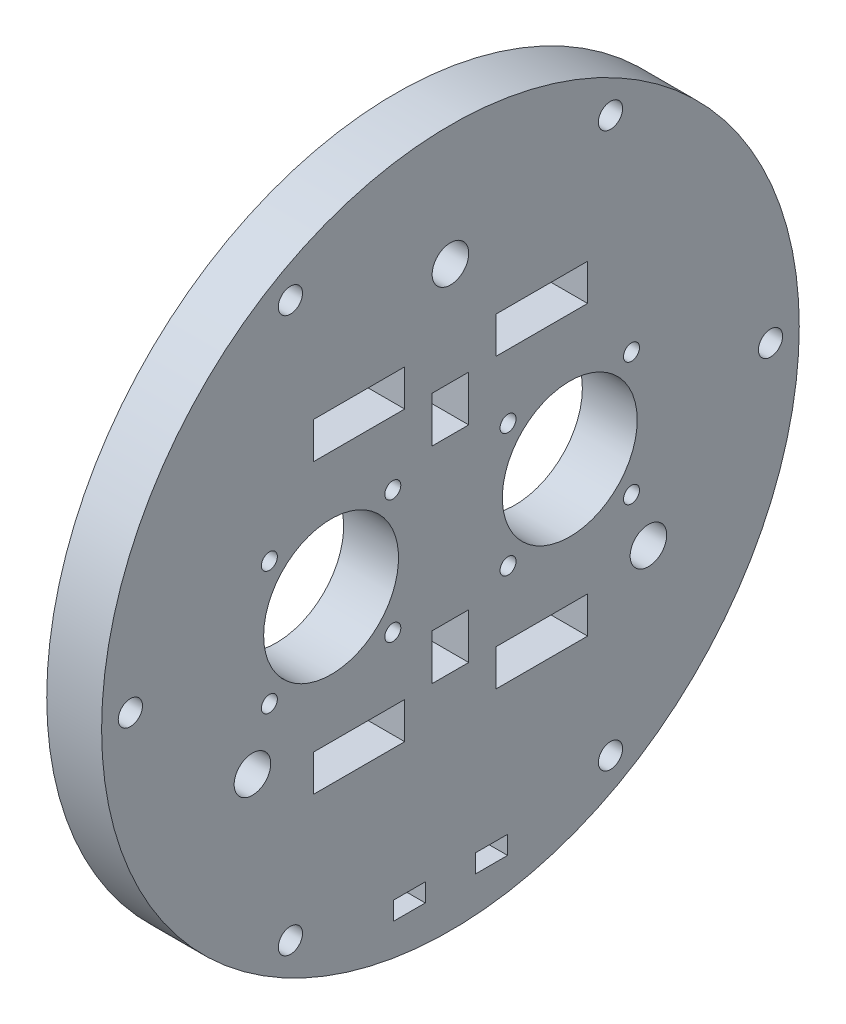
from build123d import *

# Parameters (mm, degrees)
SKETCH1_R           = 76.29
SKETCH1_R_2         = 4
SKETCH1_R_3         = 14.75
SKETCH1_R_4         = 1.75
BOSS_EXTRUDE1_DEPTH = 12
SKETCH2_W           = 20
SKETCH2_H           = 8
SKETCH2_W_2         = 8
SKETCH2_H_2         = 10
SKETCH2_W_3         = 7
SKETCH2_H_3         = 4
CUT_EXTRUDE1_DEPTH  = 8
CUT_EXTRUDE2_REACH  = 110.556
SKETCH3_R           = 2.65


with BuildPart() as part:
    # Sketch1 → Boss-Extrude1 (new body)
    with BuildSketch(Plane(origin=(0, 0, 0), x_dir=(0, 0, -1), z_dir=(1, 0, 0))):
        Circle(SKETCH1_R)
        with Locations((0, 50)):
            Circle(SKETCH1_R_2, mode=Mode.SUBTRACT)
        with Locations((43.301270189, -25)):
            Circle(SKETCH1_R_2, mode=Mode.SUBTRACT)
        with Locations((-43.301270189, -25)):
            Circle(SKETCH1_R_2, mode=Mode.SUBTRACT)
        with Locations((26.1, 0)):
            Circle(SKETCH1_R_3, mode=Mode.SUBTRACT)
        with Locations((-26.1, 0)):
            Circle(SKETCH1_R_3, mode=Mode.SUBTRACT)
        with Locations((39.596900686, 13.496900686)):
            Circle(SKETCH1_R_4, mode=Mode.SUBTRACT)
        with Locations((39.596900686, -13.496900686)):
            Circle(SKETCH1_R_4, mode=Mode.SUBTRACT)
        with Locations((12.603099314, -13.496900686)):
            Circle(SKETCH1_R_4, mode=Mode.SUBTRACT)
        with Locations((12.603099314, 13.496900686)):
            Circle(SKETCH1_R_4, mode=Mode.SUBTRACT)
        with Locations((-39.596900686, -13.496900686)):
            Circle(SKETCH1_R_4, mode=Mode.SUBTRACT)
        with Locations((-12.603099314, -13.496900686)):
            Circle(SKETCH1_R_4, mode=Mode.SUBTRACT)
        with Locations((-12.603099314, 13.496900686)):
            Circle(SKETCH1_R_4, mode=Mode.SUBTRACT)
        with Locations((-39.596900686, 13.496900686)):
            Circle(SKETCH1_R_4, mode=Mode.SUBTRACT)
    extrude(amount=BOSS_EXTRUDE1_DEPTH)

    # Sketch2 → Cut-Extrude1 (cut)
    with BuildSketch(Plane(origin=(12, 0, 0), x_dir=(0, 0, -1), z_dir=(1, 0, 0))):
        with Locations((20, -31.5)):
            Rectangle(SKETCH2_W, SKETCH2_H)
        with Locations((-20, -31.5)):
            Rectangle(SKETCH2_W, SKETCH2_H)
        with Locations((-20, 31.5)):
            Rectangle(SKETCH2_W, SKETCH2_H)
        with Locations((20, 31.5)):
            Rectangle(SKETCH2_W, SKETCH2_H)
        with Locations((0, -22.5)):
            Rectangle(SKETCH2_W_2, SKETCH2_H_2)
        with Locations((0, 22.5)):
            Rectangle(SKETCH2_W_2, SKETCH2_H_2)
        with Locations((-9, -66.29)):
            Rectangle(SKETCH2_W_3, SKETCH2_H_3)
        with Locations((9, -66.29)):
            Rectangle(SKETCH2_W_3, SKETCH2_H_3)
    extrude(amount=-CUT_EXTRUDE1_DEPTH, mode=Mode.SUBTRACT)

    # Sketch3 → Cut-Extrude2 (cut, up to next)
    with BuildSketch(Plane.ZY, mode=Mode.PRIVATE) as cut_extrude2_sk1:
        with Locations((-70, 0)):
            Circle(SKETCH3_R)
    cut_extrude2_tool1 = extrude(cut_extrude2_sk1.sketch, amount=-CUT_EXTRUDE2_REACH, mode=Mode.PRIVATE) & part.part
    # Sketch3 → Cut-Extrude2 (cut, up to next)
    with BuildSketch(Plane.ZY, mode=Mode.PRIVATE) as cut_extrude2_sk2:
        with Locations((-35, 60.621778265)):
            Circle(SKETCH3_R)
    cut_extrude2_tool2 = extrude(cut_extrude2_sk2.sketch, amount=-CUT_EXTRUDE2_REACH, mode=Mode.PRIVATE) & part.part
    # Sketch3 → Cut-Extrude2 (cut, up to next)
    with BuildSketch(Plane.ZY, mode=Mode.PRIVATE) as cut_extrude2_sk3:
        with Locations((35, 60.621778265)):
            Circle(SKETCH3_R)
    cut_extrude2_tool3 = extrude(cut_extrude2_sk3.sketch, amount=-CUT_EXTRUDE2_REACH, mode=Mode.PRIVATE) & part.part
    # Sketch3 → Cut-Extrude2 (cut, up to next)
    with BuildSketch(Plane.ZY, mode=Mode.PRIVATE) as cut_extrude2_sk4:
        with Locations((70, 0)):
            Circle(SKETCH3_R)
    cut_extrude2_tool4 = extrude(cut_extrude2_sk4.sketch, amount=-CUT_EXTRUDE2_REACH, mode=Mode.PRIVATE) & part.part
    # Sketch3 → Cut-Extrude2 (cut, up to next)
    with BuildSketch(Plane.ZY, mode=Mode.PRIVATE) as cut_extrude2_sk5:
        with Locations((35, -60.621778265)):
            Circle(SKETCH3_R)
    cut_extrude2_tool5 = extrude(cut_extrude2_sk5.sketch, amount=-CUT_EXTRUDE2_REACH, mode=Mode.PRIVATE) & part.part
    # Sketch3 → Cut-Extrude2 (cut, up to next)
    with BuildSketch(Plane.ZY, mode=Mode.PRIVATE) as cut_extrude2_sk6:
        with Locations((-35, -60.621778265)):
            Circle(SKETCH3_R)
    cut_extrude2_tool6 = extrude(cut_extrude2_sk6.sketch, amount=-CUT_EXTRUDE2_REACH, mode=Mode.PRIVATE) & part.part
    add(cut_extrude2_tool1.solids().sort_by_distance((0, 0, -70))[0], mode=Mode.SUBTRACT)
    add(cut_extrude2_tool2.solids().sort_by_distance((0, 60.621778, -35))[0], mode=Mode.SUBTRACT)
    add(cut_extrude2_tool3.solids().sort_by_distance((0, 60.621778, 35))[0], mode=Mode.SUBTRACT)
    add(cut_extrude2_tool4.solids().sort_by_distance((0, 0, 70))[0], mode=Mode.SUBTRACT)
    add(cut_extrude2_tool5.solids().sort_by_distance((0, -60.621778, 35))[0], mode=Mode.SUBTRACT)
    add(cut_extrude2_tool6.solids().sort_by_distance((0, -60.621778, -35))[0], mode=Mode.SUBTRACT)


solid = part.part
